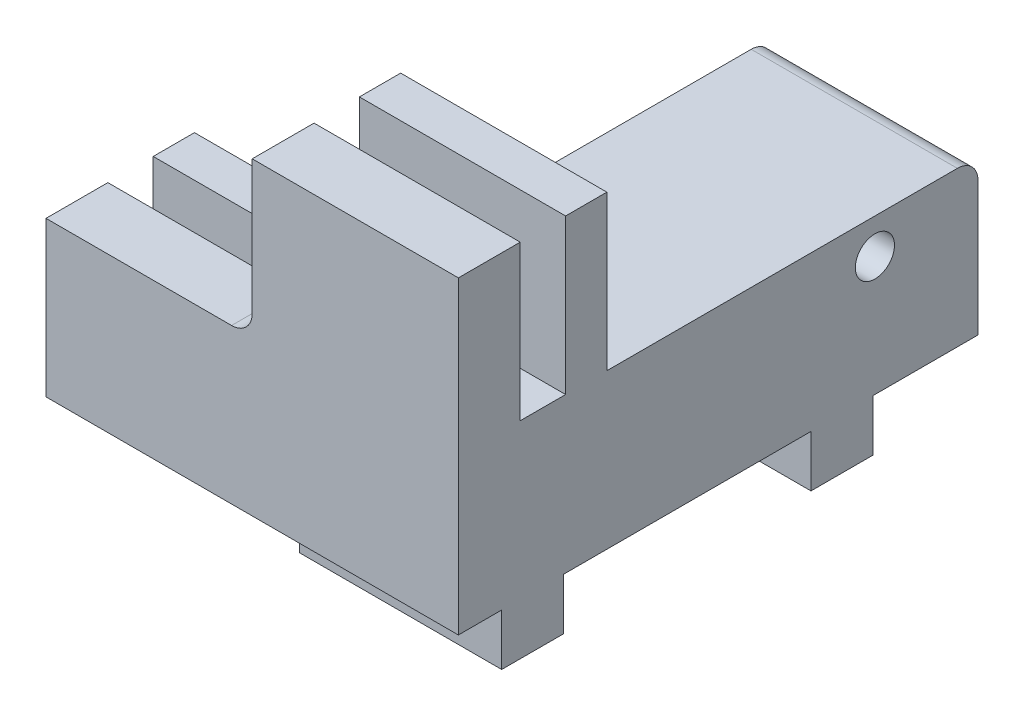
from build123d import *

# Parameters (mm, degrees)
SKETCH1_W           = 5.08
SKETCH1_H           = 8.128
BOSS_EXTRUDE1_DEPTH = 25.4
SKETCH2_W           = 5.08
SKETCH2_H           = 19.05
SKETCH2_W_2         = 7.62
SKETCH2_W_3         = 45.72
SKETCH2_R           = 2.413
BOSS_EXTRUDE2_DEPTH = 0.508
SKETCH2_3_W         = 45.72
SKETCH2_3_H         = 19.05
SKETCH2_3_R         = 2.413
BOSS_EXTRUDE3_DEPTH = 25.4
SKETCH3_W           = 5.588
SKETCH3_H           = 8.128
BOSS_EXTRUDE6_DEPTH = 24.892
FILLET1_R           = 2.54
FILLET2_R           = 2.54
BOSS_EXTRUDE7_DEPTH = 6.35


with BuildPart() as part:
    # Sketch1 → Boss-Extrude1 (new body)
    with BuildSketch(Plane(origin=(0, 0, 0), x_dir=(0, 0, -1), z_dir=(1, 0, 0))):
        Polygon((-33.416737041, 19.05), (-33.416737041, 0), (-15.128737041, 0), (-15.128737041, 10.922), (-20.208737041, 10.922), (-25.796737041, 10.922), (-25.796737041, 19.05), align=None)
        with Locations((-17.668737041, 14.986)):
            Rectangle(SKETCH1_W, SKETCH1_H)
    extrude(amount=-BOSS_EXTRUDE1_DEPTH)

    # Sketch2 → Boss-Extrude2 (add)
    # profile 1 of 4: a face of its own
    with BuildSketch(Plane(origin=(0, 0, 0), x_dir=(0, 0, -1), z_dir=(1, 0, 0))):
        Polygon((-33.416737041, 0), (-15.128737041, 0), (-15.128737041, 19.05), (-20.208737041, 19.05), (-20.208737041, 10.922), (-25.796737041, 10.922), (-25.796737041, 19.05), (-33.416737041, 19.05), align=None)
    # profile 2 of 4: a face of its own
    with BuildSketch(Plane(origin=(0, 0, 0), x_dir=(0, 0, -1), z_dir=(1, 0, 0))):
        with Locations((-17.668737041, 28.575)):
            Rectangle(SKETCH2_W, SKETCH2_H)
    # profile 3 of 4: a face of its own
    with BuildSketch(Plane(origin=(0, 0, 0), x_dir=(0, 0, -1), z_dir=(1, 0, 0))):
        with Locations((-29.606737041, 28.575)):
            Rectangle(SKETCH2_W_2, SKETCH2_H)
    # profile 4 of 4: a face of its own
    with BuildSketch(Plane(origin=(0, 0, 0), x_dir=(0, 0, -1), z_dir=(1, 0, 0))):
        with Locations((7.731262959, 9.525)):
            Rectangle(SKETCH2_W_3, SKETCH2_H)
        with Locations((17.891262959, 14.732)):
            Circle(SKETCH2_R, mode=Mode.SUBTRACT)
    extrude(amount=BOSS_EXTRUDE2_DEPTH)

    # Sketch2<3> → Boss-Extrude3 (add)
    with BuildSketch(Plane(origin=(0, 0, 0), x_dir=(0, 0, -1), z_dir=(1, 0, 0))):
        with Locations((7.731262959, 9.525)):
            Rectangle(SKETCH2_3_W, SKETCH2_3_H)
        with Locations((17.891262959, 14.732)):
            Circle(SKETCH2_3_R, mode=Mode.SUBTRACT)
    extrude(amount=BOSS_EXTRUDE3_DEPTH)

    # Sketch3 → Boss-Extrude6 (add)
    with BuildSketch(Plane(origin=(0.508, 0, 0), x_dir=(0, 0, -1), z_dir=(1, 0, 0))):
        Polygon((-33.416737041, 0), (-15.128737041, 0), (-15.128737041, 19.05), (-15.128737041, 38.1), (-20.208737041, 38.1), (-20.208737041, 10.922), (-25.796737041, 10.922), (-25.796737041, 38.1), (-33.416737041, 38.1), align=None)
        with Locations((-23.002737041, 14.986)):
            Rectangle(SKETCH3_W, SKETCH3_H)
    extrude(amount=BOSS_EXTRUDE6_DEPTH)

    # Fillet1
    # the kernel refuses this fillet: 2.54 mm, written as the material it adds along each edge
    with BuildSketch(Plane(origin=(0, 19.05, 19.446737041), x_dir=(0, 1, 0), z_dir=(0, 0, 1))) as fillet1_piece_1_section:
        with BuildLine():
            CenterArc((FILLET1_R, FILLET1_R), FILLET1_R, 180, 90)
            Line((0, FILLET1_R), (0, 0))
            Line((0, 0), (FILLET1_R, 0))
        make_face()
    fillet1_piece_1 = extrude(amount=13.97, mode=Mode.PRIVATE)
    fillet1_piece_1 = split(fillet1_piece_1, bisect_by=Plane(origin=(-0.57504359, 19.62504359, 20.208737041), z_dir=(0, 0, -1)), keep=Keep.TOP, mode=Mode.PRIVATE)
    add(fillet1_piece_1)
    with BuildSketch(Plane(origin=(0, 19.05, 25.796737041), x_dir=(0, 1, 0), z_dir=(0, 0, 1))) as fillet1_piece_2:
        with BuildLine():
            CenterArc((FILLET1_R, FILLET1_R), FILLET1_R, 180, 90)
            Line((0, FILLET1_R), (0, 0))
            Line((0, 0), (FILLET1_R, 0))
        make_face()
    extrude(amount=7.62)
    with BuildSketch(Plane(origin=(0, 19.05, 15.128737041), x_dir=(0, 1, 0), z_dir=(0, 0, 1))) as fillet1_piece_3:
        with BuildLine():
            CenterArc((FILLET1_R, FILLET1_R), FILLET1_R, 180, 90)
            Line((0, FILLET1_R), (0, 0))
            Line((0, 0), (FILLET1_R, 0))
        make_face()
    extrude(amount=5.08)
    with BuildSketch(Plane(origin=(0, 19.05, 15.128737041), x_dir=(0, 1, 0), z_dir=(0, 0, 1))) as fillet1_piece_4_section:
        with BuildLine():
            CenterArc((FILLET1_R, FILLET1_R), FILLET1_R, 180, 90)
            Line((0, FILLET1_R), (0, 0))
            Line((0, 0), (FILLET1_R, 0))
        make_face()
    fillet1_piece_4 = extrude(amount=11.43, mode=Mode.PRIVATE)
    fillet1_piece_4 = split(fillet1_piece_4, bisect_by=Plane(origin=(-0.57504359, 19.62504359, 25.796737041), z_dir=(0, 0, 1)), keep=Keep.TOP, mode=Mode.PRIVATE)
    add(fillet1_piece_4)

    # Fillet2
    fillet2_edges = [part.edges().sort_by_distance(p)[0] for p in [
        (12.7, 19.05, -30.591262959),
    ]]
    fillet(fillet2_edges, radius=FILLET2_R)

    # Sketch4 → Boss-Extrude7 (add)
    with BuildSketch(Plane.XZ):
        Polygon((0.508, 28.082737041), (0.508, 24.272737041), (0.508, 20.462737041), (25.4, 20.462737041), (25.4, 24.272737041), (25.4, 28.082737041), align=None)
        Polygon((25.4, -13.827262959), (25.4, -10.017262959), (0.508, -10.017262959), (0.508, -17.637262959), (25.4, -17.637262959), align=None)
    extrude(amount=BOSS_EXTRUDE7_DEPTH)


solid = part.part
